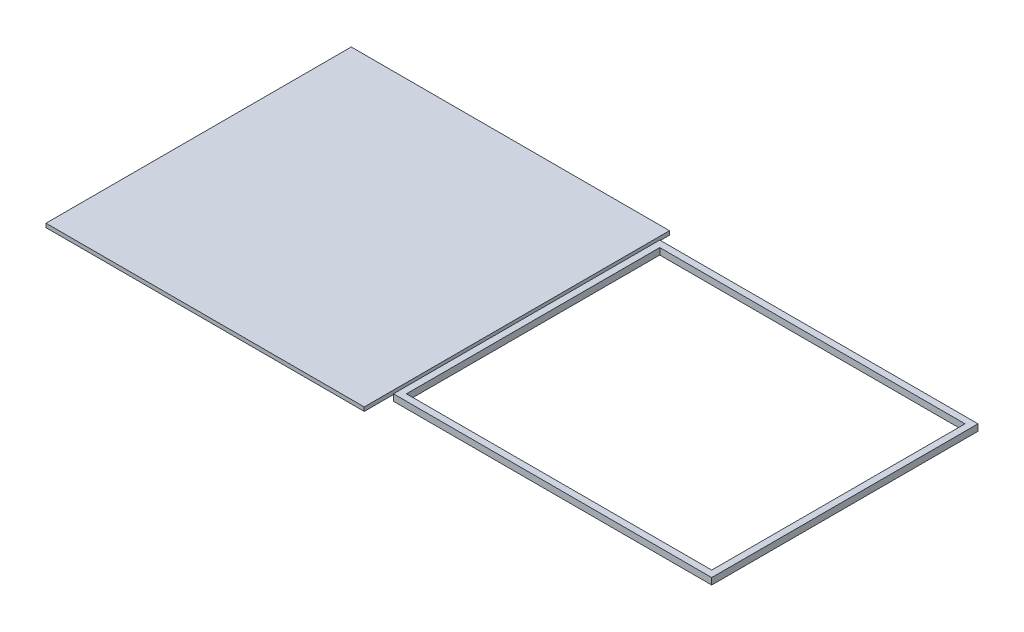
from build123d import *

# Parameters (mm, degrees)
SKETCH1_W           = 245
SKETCH1_H           = 235
BOSS_EXTRUDE1_DEPTH = 3
SKETCH2_W           = 245
SKETCH2_H           = 205
SKETCH2_W_2         = 235
SKETCH2_H_2         = 195
BOSS_EXTRUDE2_DEPTH = 5


with BuildPart() as part:
    # Sketch1 → Boss-Extrude1 (new body)
    with BuildSketch(Plane(origin=(0, 0, 0), x_dir=(1, 0, 0), z_dir=(0, 1, 0))):
        Rectangle(SKETCH1_W, SKETCH1_H)
    extrude(amount=BOSS_EXTRUDE1_DEPTH)


with BuildPart() as body_2:
    # Sketch2 → Boss-Extrude2 (new body)
    with BuildSketch(Plane(origin=(0, 3, 0), x_dir=(1, 0, 0), z_dir=(0, 1, 0))):
        with Locations((252.5, 0)):
            Rectangle(SKETCH2_W, SKETCH2_H)
        with Locations((252.5, 0)):
            Rectangle(SKETCH2_W_2, SKETCH2_H_2, mode=Mode.SUBTRACT)
    extrude(amount=BOSS_EXTRUDE2_DEPTH)


solid = Compound([part.part, body_2.part])
